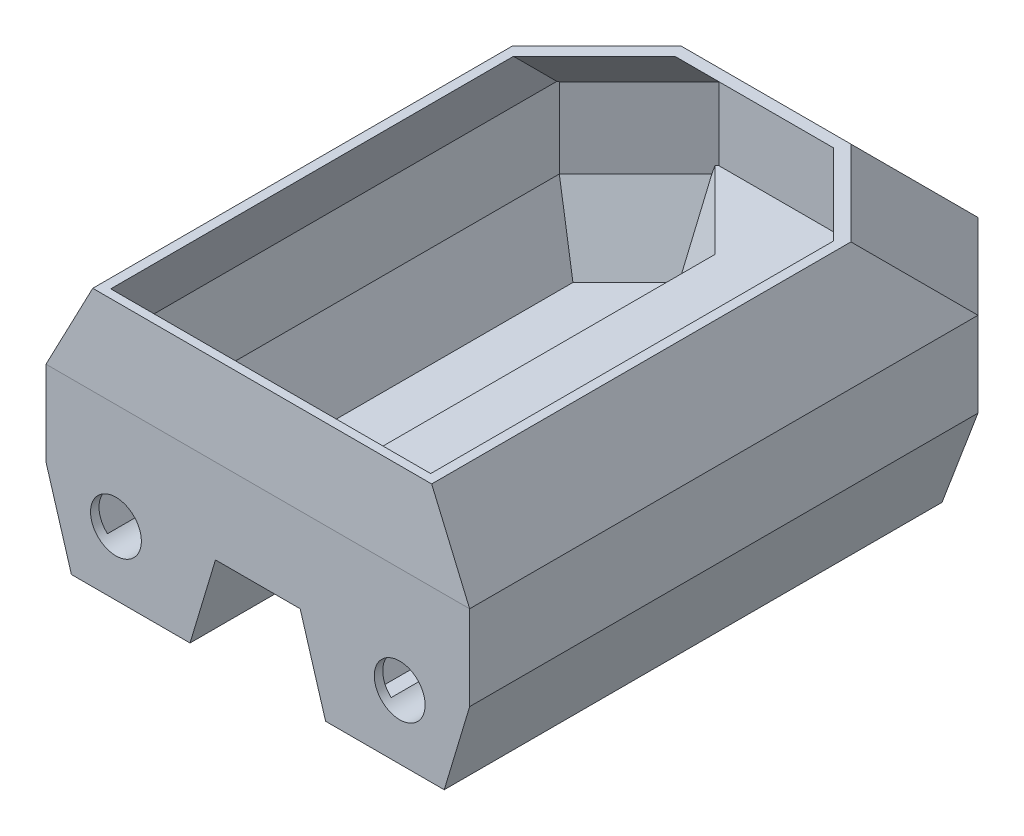
from build123d import *

# Parameters (mm, degrees)
EXTRUDE_1_DEPTH     = 10
SHELL_2_T           = -1
SKETCH_8_W          = 4
SKETCH_8_H          = 7
EXTRUDE_3_DEPTH     = 5
SKETCH_9_R          = 3
CUT_EXTRUDE_1_DEPTH = 10


with BuildPart() as part:
    # 草图3 → 凸台-拉伸1 (new body)
    with BuildSketch(Plane(origin=(0, 0, 0), x_dir=(1, 0, 0), z_dir=(0, 1, 0))):
        Polygon((-25, 35), (-25, -25), (25, -25), (25, 35), (15, 45), (-15, 45), align=None)
    extrude(amount=EXTRUDE_1_DEPTH)


with BuildPart() as body_2:
    # 草图5 → 放样1 section 0
    with BuildSketch(Plane(origin=(0, 0, 0), x_dir=(1, 0, 0), z_dir=(0, 1, 0))):
        with BuildLine():
            Line((25, 35), (15, 45))
            Line((15, 45), (5, 35))
            Line((5, 35), (5, -25))
            Line((5, -25), (25, -25))
            Line((25, -25), (25, 35))
        make_face()
    # 草图6 → 放样1 section 1
    with BuildSketch(Plane(origin=(0, -10, 0), x_dir=(1, 0, 0), z_dir=(0, 1, 0))):
        with BuildLine():
            Line((22, -25), (8, -25))
            Line((8, -25), (8, 33.757359313))
            Line((8, 33.757359313), (15, 40.757359313))
            Line((15, 40.757359313), (22, 33.757359313))
            Line((22, 33.757359313), (22, -25))
        make_face()
    loft()


with BuildPart() as body_3:
    # 镜向2: mirrored copy
    add(body_2.part.mirror(Plane(origin=(0, 0, 0), x_dir=(0, 0, 1), z_dir=(1, 0, 0))))


with BuildPart() as part_1:
    add(part.part)

    # 相交1: read off the stored shape, not the designer's step
    # 相交1: union body 3, body 2
    add(body_3.part)
    add(body_2.part)

    # 草图7 → section 1 of loft_2
    with BuildSketch(Plane(origin=(0, 20, 0), x_dir=(1, 0, 0), z_dir=(0, 1, 0)), mode=Mode.PRIVATE) as loft_2_s1:
        with BuildLine():
            Line((-20, -24.480567501), (20, -24.480567501))
            Line((20, -24.480567501), (20, 25))
            Line((20, 25), (10, 35))
            Line((10, 35), (-10, 35))
            Line((-10, 35), (-20, 25))
            Line((-20, 25), (-20, -24.480567501))
        make_face()
    # loft from a face of the part (loft_2)
    loft([part_1.faces().sort_by_distance((0, 10, -9.068627451))[0], loft_2_s1.sketch])

    # 抽壳2
    shell_2_openings = [part_1.faces().sort_by_distance(p)[0] for p in [
        (0, 20, -4.10112168),
    ]]
    offset(amount=SHELL_2_T, openings=shell_2_openings, kind=Kind.INTERSECTION)

    # 草图8 → 凸台-拉伸3 (add)
    with BuildSketch(Plane(origin=(0, -9, 0), x_dir=(1, 0, 0), z_dir=(0, 1, 0))):
        with Locations((-16.744030651, -20.5)):
            Rectangle(SKETCH_8_W, SKETCH_8_H)
    extrude_3 = extrude(amount=EXTRUDE_3_DEPTH)

    # 草图9 → 切除-拉伸1 (cut)
    with BuildSketch(Plane.XY.offset(25)):
        with Locations((-16.744030651, -2.467331557)):
            Circle(SKETCH_9_R)
    cut_extrude_1 = extrude(amount=-CUT_EXTRUDE_1_DEPTH, mode=Mode.SUBTRACT)

    # 镜向3: 凸台-拉伸3, 切除-拉伸1 across plane
    add(extrude_3.mirror(Plane(origin=(0, 0, 0), x_dir=(0, 0, 1), z_dir=(1, 0, 0))))
    add(cut_extrude_1.mirror(Plane(origin=(0, 0, 0), x_dir=(0, 0, 1), z_dir=(1, 0, 0))), mode=Mode.SUBTRACT)


solid = part_1.part
